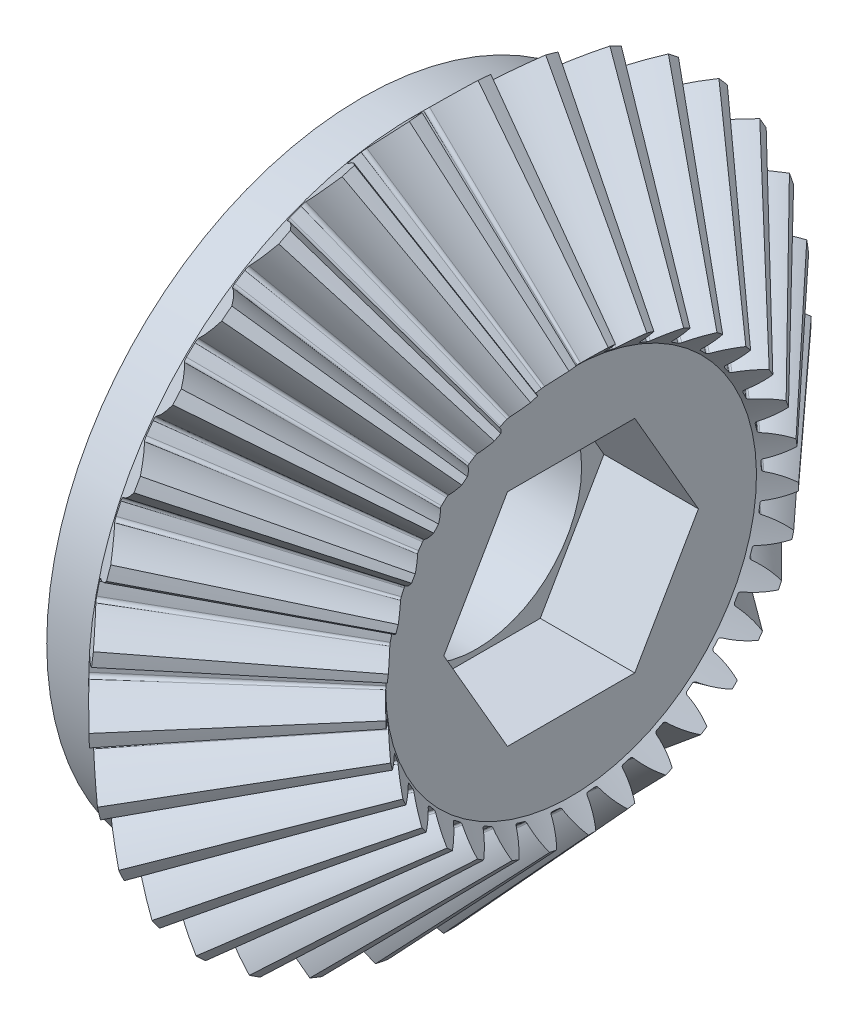
from build123d import *

# Parameters (mm, degrees)
TEETHCUTS_COUNT       = 33
TEETHCUTS_ANGLE       = 349.090909091
HUBSKE_R              = 15
HUB_DEPTH             = 2.449164146
BORSKE_R              = 5
BORE_DEPTH            = 20.0000508
CORTAR_EXTRUIR1_DEPTH = 4.5


with BuildPart() as part:
    # BasProSke → Base-Revolve (revolve)
    with BuildSketch(Plane(origin=(0, 0, 0), x_dir=(1, 0, 0), z_dir=(0, 1, 0)), mode=Mode.PRIVATE) as base_revolve_sk:
        Polygon((0, 0), (0, 15.449062547), (1.758044236, 17.207106781), (8.526081738, 9.833008659), (7.521446594, 8.828373517), (7.521446594, 0), align=None)
    revolve(base_revolve_sk.sketch.rotate(Axis((-10, 0, 0), (1, 0, 0)), 180), axis=Axis((-10, 0, 0), (1, 0, 0)))

    # ToothCut: read off the stored shape, not the designer's step
    # ToothCut: loft between two sections, ruled curve by curve
    toothcut_from = [
        Edge.make_bspline([(17.557371624, 0.006434169, -0.008859602), (17.552987386, 0.002049932, -0.015227606), (17.546735772, -0.004201682, -0.014317002), (17.543361398, -0.007576056, -0.006818885)], [0, 0, 0, 0, 1, 1, 1, 1], 3, [1, 0.74701913, 0.74701913, 1]),
        Edge.make_bspline([(17.543361398, -0.007576056, 0.006818885), (17.546735772, -0.004201682, 0.014317002), (17.552987386, 0.002049932, 0.015227606), (17.557371624, 0.006434169, 0.008859602)], [0, 0, 0, 0, 1, 1, 1, 1], 3, [1, 0.74701913, 0.74701913, 1]),
        Edge.make_bspline([(17.543361398, -0.007576056, -0.006818885), (17.542947276, -0.007990178, -0.005898674), (17.542619935, -0.008317519, -0.004911011), (17.542384772, -0.008552683, -0.003872176)], [0, 0, 0, 0, 1, 1, 1, 1], 3, [1, 0.994505488, 0.994505488, 1]),
        Edge.make_bspline([(17.542384772, -0.008552683, 0.003872176), (17.542619935, -0.008317519, 0.004911011), (17.542947276, -0.007990178, 0.005898674), (17.543361398, -0.007576056, 0.006818885)], [0, 0, 0, 0, 1, 1, 1, 1], 3, [1, 0.994505488, 0.994505488, 1]),
        Edge.make_bspline([(17.542384772, -0.008552683, -0.003872176), (17.541809982, -0.009127473, -0.00133304), (17.541809982, -0.009127473, 0.00133304), (17.542384772, -0.008552683, 0.003872176)], [0, 0, 0, 0, 1, 1, 1, 1], 3, [1, 0.968257159, 0.968257159, 1]),
        Edge.make_line((17.557371624, 0.006434169, 0.008859602), (17.557371624, 0.006434169, -0.008859602)),
    ]
    toothcut_to = [
        Edge.make_bspline([(1.957843945, 17.406906489, -1.550186802), (1.462436883, 16.911499428, -1.039232437), (0.9062007, 16.355263246, -0.674358083), (0.310395439, 15.759457986, -0.469509697)], [0, 0, 0, 0, 1, 1, 1, 1], 3, [1, 0.987259582, 0.987259582, 1]),
        Edge.make_bspline([(0.310395439, 15.759457986, 0.469509697), (0.9062007, 16.355263246, 0.674358083), (1.462436883, 16.911499428, 1.039232437), (1.957843945, 17.406906489, 1.550186802)], [0, 0, 0, 0, 1, 1, 1, 1], 3, [1, 0.987259582, 0.987259582, 1]),
        Edge.make_bspline([(0.310395439, 15.759457986, -0.469509697), (0.246991047, 15.696053594, -0.447710146), (0.207142743, 15.65620529, -0.374637034), (0.208346141, 15.657408688, -0.28237351)], [0, 0, 0, 0, 1, 1, 1, 1], 3, [1, 0.853648189, 0.853648189, 1]),
        Edge.make_bspline([(0.208346141, 15.657408688, 0.28237351), (0.207142743, 15.65620529, 0.374637034), (0.246991047, 15.696053594, 0.447710146), (0.310395439, 15.759457986, 0.469509697)], [0, 0, 0, 0, 1, 1, 1, 1], 3, [1, 0.853648189, 0.853648189, 1]),
        Edge.make_bspline([(0.208346141, 15.657408688, -0.28237351), (0.210801344, 15.659863891, -0.094135177), (0.210801344, 15.659863891, 0.094135177), (0.208346141, 15.657408688, 0.28237351)], [0, 0, 0, 0, 1, 1, 1, 1], 3, [1, 0.999886615, 0.999886615, 1]),
        Edge.make_line((1.957843945, 17.406906489, 1.550186802), (1.957843945, 17.406906489, -1.550186802)),
    ]
    toothcut = Solid(Shell([*[Face.make_surface_from_curves(toothcut_from[k], toothcut_to[k]) for k in range(6)], Face(Wire(toothcut_from)), Face(Wire(toothcut_to))]))
    add(toothcut, mode=Mode.SUBTRACT)

    # TeethCuts: ToothCut ×33 about axis
    teethcuts_axis = Axis((-10, 0, 0), (1, 0, 0))
    for i in range(1, TEETHCUTS_COUNT):
        add(toothcut.rotate(teethcuts_axis, i * TEETHCUTS_ANGLE / (TEETHCUTS_COUNT - 1)), mode=Mode.SUBTRACT)

    # HubSke → Hub (add)
    with BuildSketch(Plane.ZY):
        with Locations(Location((0, 0, 0), (0, 0, 180))):
            Circle(HUBSKE_R)
    extrude(amount=HUB_DEPTH)

    # BorSke → Bore (cut, symmetric)
    with BuildSketch(Plane(origin=(0, 0, 0), x_dir=(0, 0, -1), z_dir=(1, 0, 0))):
        with Locations(Location((0, 0, 0), (0, 0, 180))):
            Circle(BORSKE_R)
    extrude(amount=BORE_DEPTH, both=True, mode=Mode.SUBTRACT)

    # Croquis1 → Cortar-Extruir1 (cut)
    with BuildSketch(Plane(origin=(7.521446594, 0, 0), x_dir=(0, 0, -1), z_dir=(1, 0, 0))):
        Polygon((3.031088913, 5.25), (-3.031088913, 5.25), (-6.062177826, 0), (-3.031088913, -5.25), (3.031088913, -5.25), (6.062177826, 0), align=None)
    extrude(amount=-CORTAR_EXTRUIR1_DEPTH, mode=Mode.SUBTRACT)


solid = part.part
